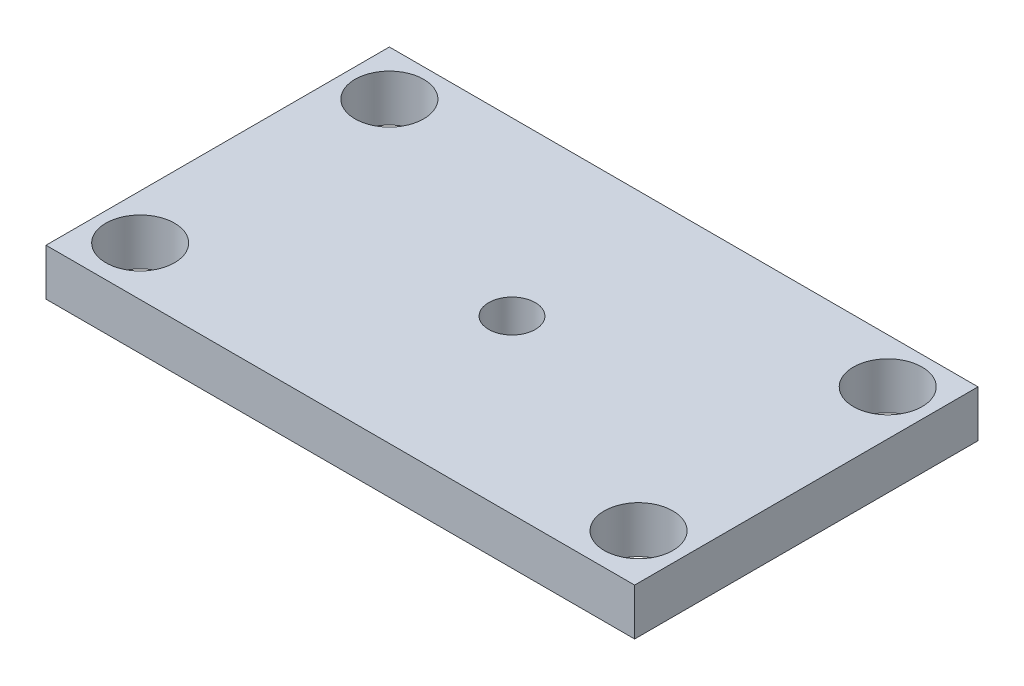
from build123d import *

# Parameters (mm, degrees)
SKETCH1_W           = 60
SKETCH1_H           = 35
SKETCH1_R           = 3.5
SKETCH1_R_2         = 2.375
BOSS_EXTRUDE1_DEPTH = 4.7625


with BuildPart() as part:
    # Sketch1 → Boss-Extrude1 (new body)
    with BuildSketch(Plane(origin=(0, 0, 0), x_dir=(1, 0, 0), z_dir=(0, 1, 0))):
        with Locations((30, 17.5)):
            Rectangle(SKETCH1_W, SKETCH1_H)
        with Locations((4.6, 30.4)):
            Circle(SKETCH1_R, mode=Mode.SUBTRACT)
        with Locations((55.4, 30.4)):
            Circle(SKETCH1_R, mode=Mode.SUBTRACT)
        with Locations((4.6, 5)):
            Circle(SKETCH1_R, mode=Mode.SUBTRACT)
        with Locations((55.4, 5)):
            Circle(SKETCH1_R, mode=Mode.SUBTRACT)
        with Locations((30, 17.5)):
            Circle(SKETCH1_R_2, mode=Mode.SUBTRACT)
    extrude(amount=BOSS_EXTRUDE1_DEPTH)


solid = part.part
